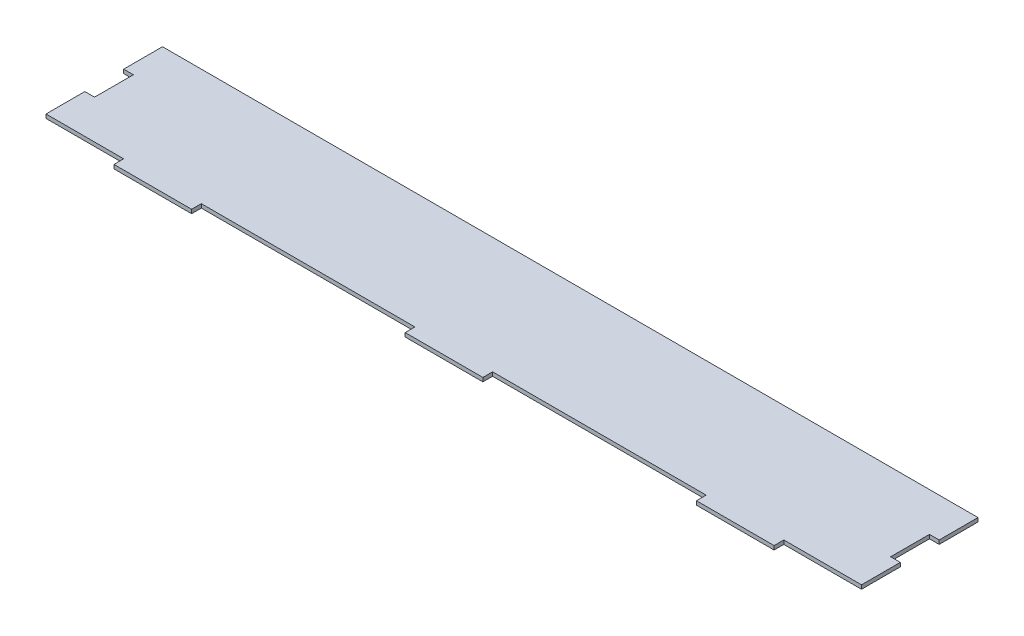
from build123d import *

# Parameters (mm, degrees)
BOSS_EXTRUDE1_DEPTH = 2.54
SHELL1_START        = 6.4516
SHELL1_OUTLINE_W    = 2.3368
SHELL1_OUTLINE_H    = 75.9968
SHELL1_DEPTH        = 520.4968
SHELL1_START_2      = 0.1016
SHELL1_2_OUTLINE_W  = 2.3368
SHELL1_2_OUTLINE_H  = 25.1968
SHELL1_2_DEPTH      = 533.1968
SHELL1_START_3      = 50.9016
SHELL1_3_OUTLINE_W  = 2.3368
SHELL1_3_OUTLINE_H  = 6.35
SHELL1_3_DEPTH      = 50.5968
SHELL1_START_4      = 241.4016
SHELL1_4_OUTLINE_W  = 2.3368
SHELL1_4_OUTLINE_H  = 6.35
SHELL1_4_DEPTH      = 50.5968
SHELL1_START_5      = 431.9016
SHELL1_5_OUTLINE_W  = 2.3368
SHELL1_5_OUTLINE_H  = 6.35
SHELL1_5_DEPTH      = 50.5968


# Read off the part's stored shape, not the designer's step: Shell1
with BuildPart() as part:
    # Sketch1 → Boss-Extrude1 (new body)
    with BuildSketch(Plane(origin=(0, 0, 0), x_dir=(1, 0, 0), z_dir=(0, 1, 0))):
        Polygon((292.1, -76.2), (292.1, -82.55), (241.3, -82.55), (241.3, -76.2), (101.6, -76.2), (101.6, -82.55), (50.8, -82.55), (50.8, -76.2), (0, -76.2), (0, -50.8), (6.35, -50.8), (6.35, -25.4), (0, -25.4), (0, 0), (533.4, 0), (533.4, -25.4), (527.05, -25.4), (527.05, -50.8), (533.4, -50.8), (533.4, -76.2), (482.6, -76.2), (482.6, -82.55), (431.8, -82.55), (431.8, -76.2), align=None)
    extrude(amount=BOSS_EXTRUDE1_DEPTH)

    # Shell1 outline → Shell1 (cut)
    with BuildSketch(Plane.YZ.offset(SHELL1_START)):
        with Locations((1.27, 38.1)):
            Rectangle(SHELL1_OUTLINE_W, SHELL1_OUTLINE_H)
    extrude(amount=SHELL1_DEPTH, mode=Mode.SUBTRACT)

    # Shell1 2 outline → Shell1 2 (cut)
    with BuildSketch(Plane.YZ.offset(SHELL1_START_2)):
        with Locations((1.27, 63.5)):
            Rectangle(SHELL1_2_OUTLINE_W, SHELL1_2_OUTLINE_H)
        with Locations((1.27, 12.7)):
            Rectangle(SHELL1_2_OUTLINE_W, SHELL1_2_OUTLINE_H)
    extrude(amount=SHELL1_2_DEPTH, mode=Mode.SUBTRACT)

    # Shell1 3 outline → Shell1 3 (cut)
    with BuildSketch(Plane.YZ.offset(SHELL1_START_3)):
        with Locations((1.27, 79.2734)):
            Rectangle(SHELL1_3_OUTLINE_W, SHELL1_3_OUTLINE_H)
    extrude(amount=SHELL1_3_DEPTH, mode=Mode.SUBTRACT)

    # Shell1 4 outline → Shell1 4 (cut)
    with BuildSketch(Plane.YZ.offset(SHELL1_START_4)):
        with Locations((1.27, 79.2734)):
            Rectangle(SHELL1_4_OUTLINE_W, SHELL1_4_OUTLINE_H)
    extrude(amount=SHELL1_4_DEPTH, mode=Mode.SUBTRACT)

    # Shell1 5 outline → Shell1 5 (cut)
    with BuildSketch(Plane.YZ.offset(SHELL1_START_5)):
        with Locations((1.27, 79.2734)):
            Rectangle(SHELL1_5_OUTLINE_W, SHELL1_5_OUTLINE_H)
    extrude(amount=SHELL1_5_DEPTH, mode=Mode.SUBTRACT)


solid = part.part
